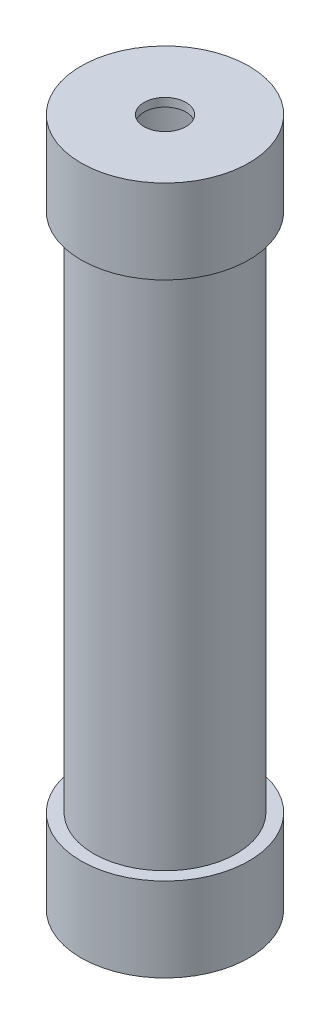
from build123d import *
from build123d.topology import SkipClean

# Parameters (mm, degrees)
EXTRUDE_1_DEPTH = 20
EXTRUDE_START   = -2
EXTRUDE_2_DEPTH = 2
EXTRUDE_START_2 = -124
EXTRUDE_3_DEPTH = 124
EXTRUDE_START_3 = 20
EXTRUDE_4_DEPTH = 20


with BuildPart() as part:
    # 草图1 → 凸台-拉伸1 (new body)
    with BuildSketch(Plane(origin=(0, 0, 0), x_dir=(1, 0, 0), z_dir=(0, 1, 0))):
        with BuildLine():
            Line((0, 20), (0, 15))
            ThreePointArc((0, 15), (15, 0), (0, -15))
            Line((0, -15), (0, -20))
            ThreePointArc((0, -20), (20, 0), (0, 20))
        make_face()
    extrude_1 = extrude(amount=EXTRUDE_1_DEPTH)

    # 草图2 → 凸台-拉伸2 (add)
    with BuildSketch(Plane(origin=(0, 20, 0), x_dir=(1, 0, 0), z_dir=(0, 1, 0)).offset(EXTRUDE_START)):
        with BuildLine():
            Line((0, 20), (0, 5))
            ThreePointArc((0, 5), (5, 0), (0, -5))
            Line((0, -5), (0, -20))
            ThreePointArc((0, -20), (20, 0), (0, 20))
        make_face()
    extrude_2 = extrude(amount=EXTRUDE_2_DEPTH)

    # 草图3 → 凸台-拉伸3 (add)
    with BuildSketch(Plane(origin=(0, 0, 0), x_dir=(1, 0, 0), z_dir=(0, 1, 0)).offset(EXTRUDE_START_2)):
        with BuildLine():
            Line((0, 17), (0, 15))
            ThreePointArc((0, 15), (15, 0), (0, -15))
            Line((0, -15), (0, -17))
            ThreePointArc((0, -17), (17, 0), (0, 17))
        make_face()
    extrude_3 = extrude(amount=EXTRUDE_3_DEPTH)

    # 草图4 → 凸台-拉伸4 (add)
    with BuildSketch(Plane.XZ.offset(124).offset(EXTRUDE_START_3)):
        with BuildLine():
            Line((0, 20), (0, 15))
            ThreePointArc((0, 15), (15, 0), (0, -15))
            Line((0, -15), (0, -20))
            ThreePointArc((0, -20), (20, 0), (0, 20))
        make_face()
    extrude_4 = extrude(amount=-EXTRUDE_4_DEPTH)


with BuildPart() as mirror_1_1:
    # 镜向1: 凸台-拉伸1, 凸台-拉伸2, 凸台-拉伸3, 凸台-拉伸4 across Right Plane
    add(extrude_1.mirror(Plane(origin=(0, 0, 0), x_dir=(0, 0, -1), z_dir=(1, 0, 0))))
    add(extrude_2.mirror(Plane(origin=(0, 0, 0), x_dir=(0, 0, -1), z_dir=(1, 0, 0))))
    add(extrude_3.mirror(Plane(origin=(0, 0, 0), x_dir=(0, 0, -1), z_dir=(1, 0, 0))))
    add(extrude_4.mirror(Plane(origin=(0, 0, 0), x_dir=(0, 0, -1), z_dir=(1, 0, 0))))


with BuildPart() as part_1:
    add(part.part)

    # 镜向1 united with what the copies tou: union 镜向1_1
    add(mirror_1_1.part)


solid = part_1.part
